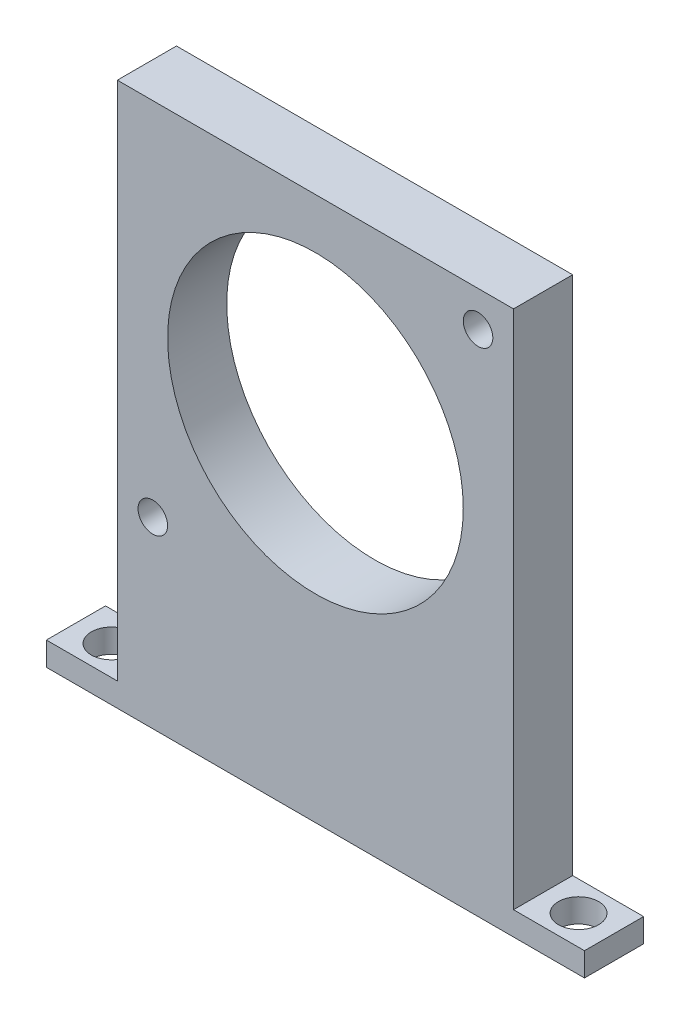
from build123d import *

# Parameters (mm, degrees)
BOSS_EXTRUDE1_DEPTH    = 5
M3X0_5_TAPPED_HOLE1_D  = 2.5
M3_CLEARANCE_HOLE2_D   = 3.4
F_25_0MM_DOWEL_HOLE1_D = 25


with BuildPart() as part:
    # Sketch1 → Boss-Extrude1 (new body)
    with BuildSketch(Plane.XY):
        Polygon((0, 0), (45.5, 0), (45.5, 2), (39.5, 2), (39.5, 46), (6, 46), (6, 2), (0, 2), align=None)
    extrude(amount=BOSS_EXTRUDE1_DEPTH)

    # M3x0.5 Tapped Hole1 (through all)
    with Locations(Plane(origin=(36.5, 43, 5), x_dir=(1, 0, 0), z_dir=(0, 0, 1))):
        with Locations((0, 0), (-27.5, -27.5)):
            Hole(M3X0_5_TAPPED_HOLE1_D / 2)

    # M3 Clearance Hole2 (through all)
    with Locations(Plane(origin=(42.5, 2, 2.5), x_dir=(0, 0, 1), z_dir=(0, 1, 0))):
        with Locations((0, 0), (0, -39.5)):
            Hole(M3_CLEARANCE_HOLE2_D / 2)

    # Ø25.0mm Dowel Hole1 (through all)
    with Locations(Plane.XY.offset(5)):
        with Locations((22.75, 29.25)):
            Hole(F_25_0MM_DOWEL_HOLE1_D / 2)


solid = part.part
